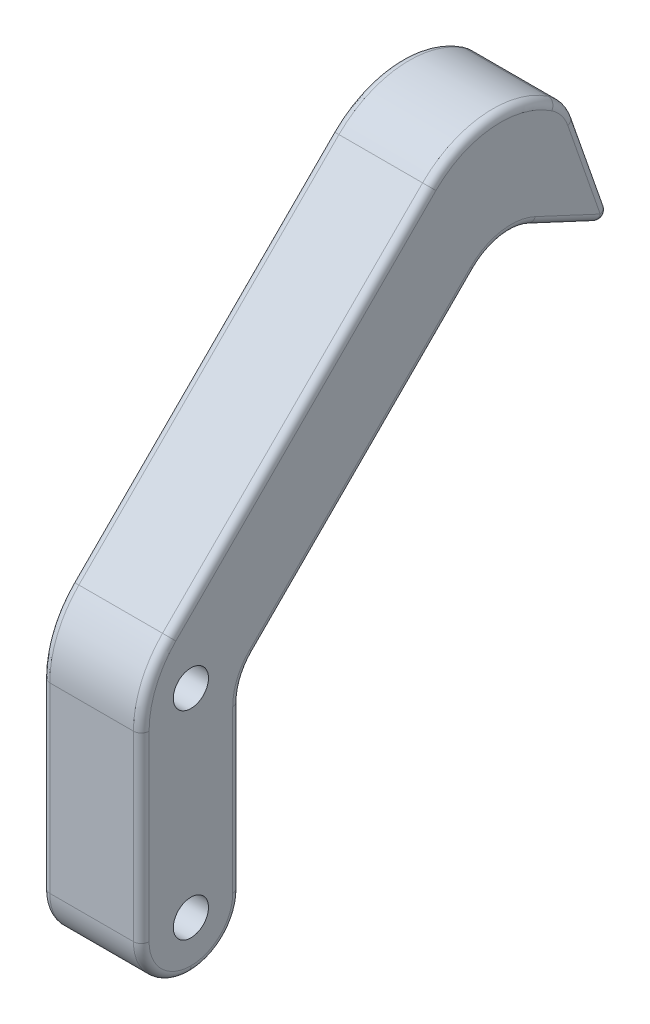
from build123d import *

# Parameters (mm, degrees)
SKETCH1_R           = 2.25
BOSS_EXTRUDE1_DEPTH = 12.7
FILLET1_R           = 12.7
FILLET2_R           = 6.35
FILLET3_R           = 1


with BuildPart() as part:
    # Sketch1 → Boss-Extrude1 (new body)
    # profile 1 of 2: a face of its own
    with BuildSketch(Plane(origin=(0, 0, 0), x_dir=(0, 0, -1), z_dir=(1, 0, 0))):
        Polygon((48.592196898, 40.156684656), (39.611940777, 49.136940777), (-6.35, 3.175), (-6.35, -31.75), (6.35, -31.75), (6.35, -2.085512242), align=None)
        with Locations((0, -25.4)):
            Circle(SKETCH1_R, mode=Mode.SUBTRACT)
        Circle(SKETCH1_R, mode=Mode.SUBTRACT)
    # profile 2 of 2: a face of its own
    with BuildSketch(Plane(origin=(0, 0, 0), x_dir=(0, 0, -1), z_dir=(1, 0, 0))):
        Polygon((54.079029807, 24.430314129), (48.592196898, 40.156684656), (39.611940777, 31.176428535), align=None)
    extrude(amount=BOSS_EXTRUDE1_DEPTH)

    # Fillet1
    fillet1_edges = [part.edges().sort_by_distance(p)[0] for p in [
        (6.35, 3.175, 6.35),
        (6.35, 49.136940777, -39.611940777),
    ]]
    fillet(fillet1_edges, radius=FILLET1_R - 0.0001)  # a hair under: the kernel refuses the full size

    # Fillet2
    fillet2_edges = [part.edges().sort_by_distance(p)[0] for p in [
        (6.35, 31.176428535, -39.611940777),
        (6.35, -2.085512242, -6.35),
    ]]
    fillet(fillet2_edges, radius=FILLET2_R)
    fillet2_2_edges = [part.edges().sort_by_distance(p)[0] for p in [
        (6.35, 40.156684656, -48.592196898),
        (6.35, -31.75, 6.35),
        (6.35, -31.75, -6.35),
    ]]
    fillet(fillet2_2_edges, radius=FILLET2_R - 0.0004)  # a hair under: the kernel refuses the full size

    # Fillet3
    fillet3_edges = [part.edges().sort_by_distance(p)[0] for p in [
        (0, 26.863823768, -48.860351546),
        (6.35, 24.430314129, -54.079029807),
        (0, -13.74293541, 6.35),
        (12.7, -13.74293541, 6.35),
        (0, 23.525734978, -14.000734978),
        (0, 43.818086311, -38.395583818),
        (0, 2.774570502, 5.383277675),
        (12.7, 23.525734978, -14.000734978),
        (12.7, 2.774570502, 5.383277675),
        (12.7, 43.818086311, -38.395583818),
        (0, 31.48135692, -51.618964812),
        (0, 13.903383358, -22.338895601),
        (12.7, 26.863823768, -48.860351546),
        (0, -15.058084182, -6.35),
        (0, -29.890245218, -4.490245218),
        (0, -29.890245218, 4.490245218),
        (0, 40.316018936, -48.193567347),
        (12.7, 31.48135692, -51.618964812),
        (12.7, -15.058084182, -6.35),
        (12.7, 13.903383358, -22.338895601),
        (12.7, -29.890245218, -4.490245218),
        (12.7, -29.890245218, 4.490245218),
        (12.7, 40.316018936, -48.193567347),
        (0, 29.795808191, -39.855381394),
        (12.7, 29.795808191, -39.855381394),
        (0, -2.285728568, -6.833364969),
        (12.7, -2.285728568, -6.833364969),
    ]]
    fillet(fillet3_edges, radius=FILLET3_R)


solid = part.part
